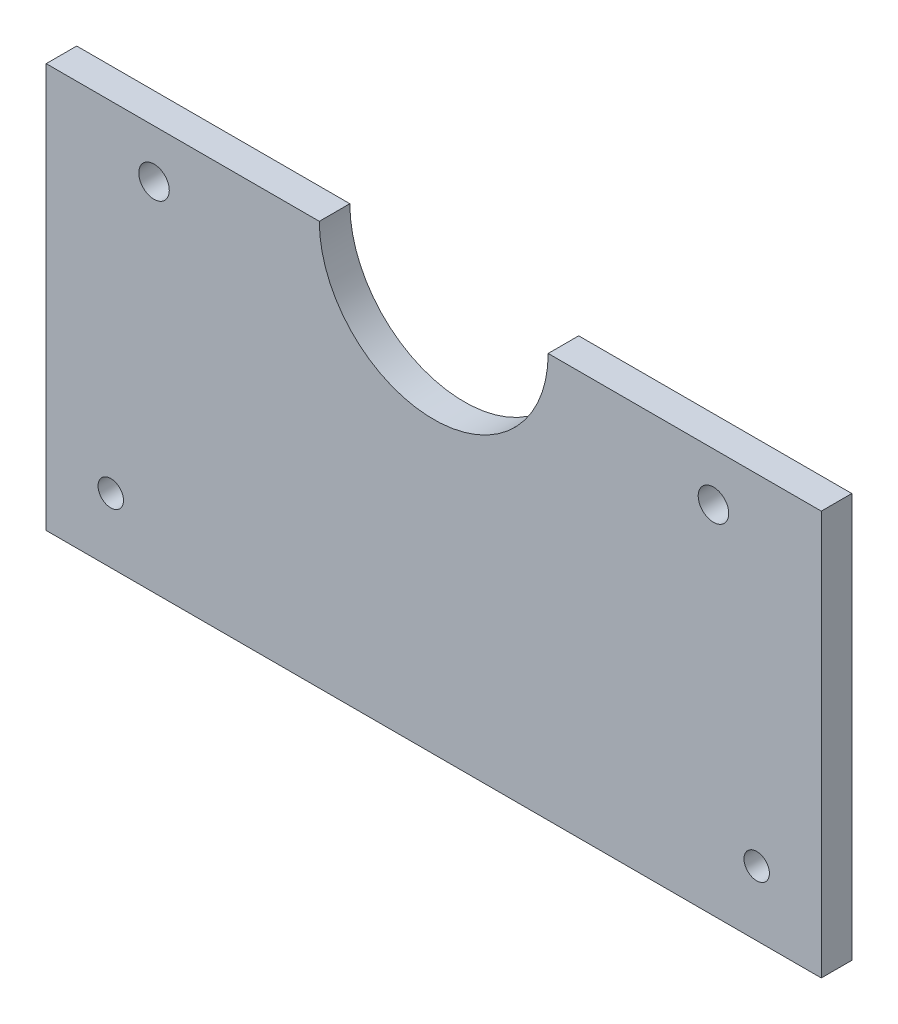
from build123d import *

# Parameters (mm, degrees)
SKETCH2_R           = 3
BOSS_EXTRUDE1_DEPTH = 3
SKETCH3_R           = 2.5
CUT_EXTRUDE1_DEPTH  = 6


with BuildPart() as part:
    # Sketch2 → Boss-Extrude1 (new, symmetric)
    with BuildSketch(Plane.XY):
        with BuildLine():
            Line((-76.2, 0), (76.2, 0))
            Line((76.2, 0), (76.2, 79.5))
            Line((76.2, 79.5), (22.5, 79.5))
            ThreePointArc((22.5, 79.5), (0, 57), (-22.5, 79.5))
            Line((-22.5, 79.5), (-76.2, 79.5))
            Line((-76.2, 79.5), (-76.2, 0))
        make_face()
        with Locations((-55, 70)):
            Circle(SKETCH2_R, mode=Mode.SUBTRACT)
        with Locations((55, 70)):
            Circle(SKETCH2_R, mode=Mode.SUBTRACT)
    extrude(amount=BOSS_EXTRUDE1_DEPTH, both=True)

    # Sketch3 → Cut-Extrude1 (cut)
    with BuildSketch(Plane.XY.offset(3)):
        with Locations((-63.5, 12.7)):
            Circle(SKETCH3_R)
        with Locations((63.5, 12.7)):
            Circle(SKETCH3_R)
    extrude(amount=-CUT_EXTRUDE1_DEPTH, mode=Mode.SUBTRACT)


solid = part.part
